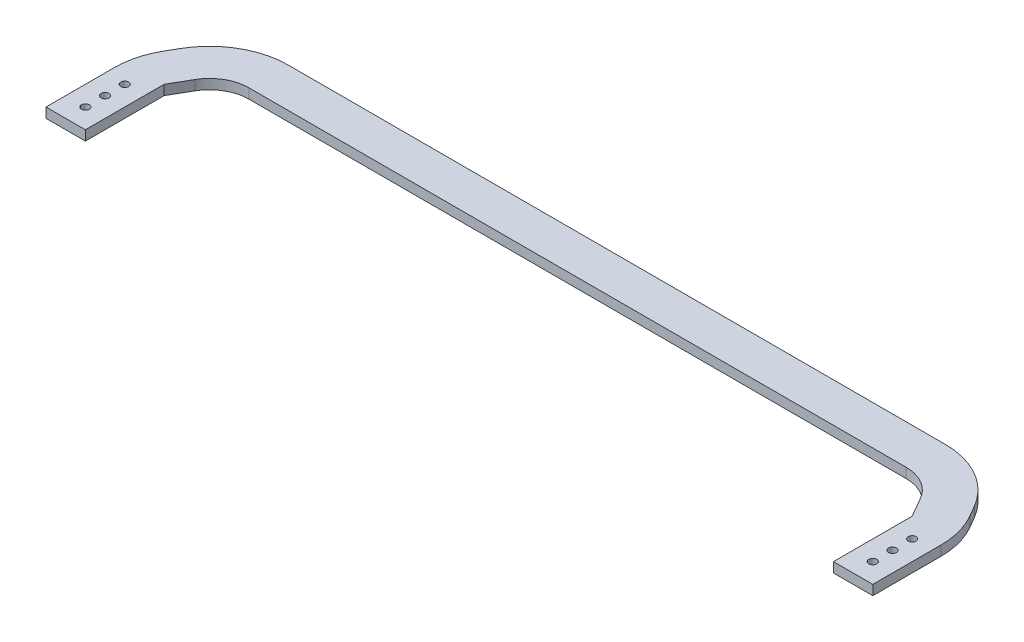
from build123d import *

# Parameters (mm, degrees)
BOSS_EXTRUDE1_DEPTH    = 6.35
F_10_CLEARANCE_HOLE1_D = 5.1054


with BuildPart() as part:
    # Sketch1 → Boss-Extrude1 (new body)
    with BuildSketch(Plane(origin=(0, 0, 0), x_dir=(1, 0, 0), z_dir=(0, 1, 0))):
        with BuildLine():
            Line((-241.3, -50.8), (-241.3, 0))
            Line((-241.3, 0), (-233.967651581, 12.7))
            ThreePointArc((-233.967651581, 12.7), (-224.670606325, 21.997045256), (-211.970606325, 25.4))
            Line((-211.970606325, 25.4), (211.970606325, 25.4))
            ThreePointArc((211.970606325, 25.4), (224.670606325, 21.997045256), (233.967651581, 12.7))
            Line((233.967651581, 12.7), (241.3, 0))
            Line((241.3, 0), (241.3, -50.8))
            Line((241.3, -50.8), (266.7, -50.8))
            Line((266.7, -50.8), (266.7, -6.805909488))
            ThreePointArc((266.7, -6.805909488), (264.969031975, 6.342098003), (259.894090512, 18.594090512))
            Line((259.894090512, 18.594090512), (255.964696837, 25.4))
            ThreePointArc((255.964696837, 25.4), (237.370606325, 43.994090512), (211.970606325, 50.8))
            Line((211.970606325, 50.8), (-211.970606325, 50.8))
            ThreePointArc((-211.970606325, 50.8), (-237.370606325, 43.994090512), (-255.964696837, 25.4))
            Line((-255.964696837, 25.4), (-259.894090512, 18.594090512))
            ThreePointArc((-259.894090512, 18.594090512), (-264.969031975, 6.342098003), (-266.7, -6.805909488))
            Line((-266.7, -6.805909488), (-266.7, -50.8))
            Line((-266.7, -50.8), (-241.3, -50.8))
        make_face()
    extrude(amount=BOSS_EXTRUDE1_DEPTH)

    # #10 Clearance Hole1 (through all)
    with Locations(Plane(origin=(0, 6.35, 0), x_dir=(1, 0, 0), z_dir=(0, 1, 0))):
        with Locations((-254, -38.1), (-254, -25.4), (-254, -12.7), (254, -12.7), (254, -25.4), (254, -38.1)):
            Hole(F_10_CLEARANCE_HOLE1_D / 2)


solid = part.part
